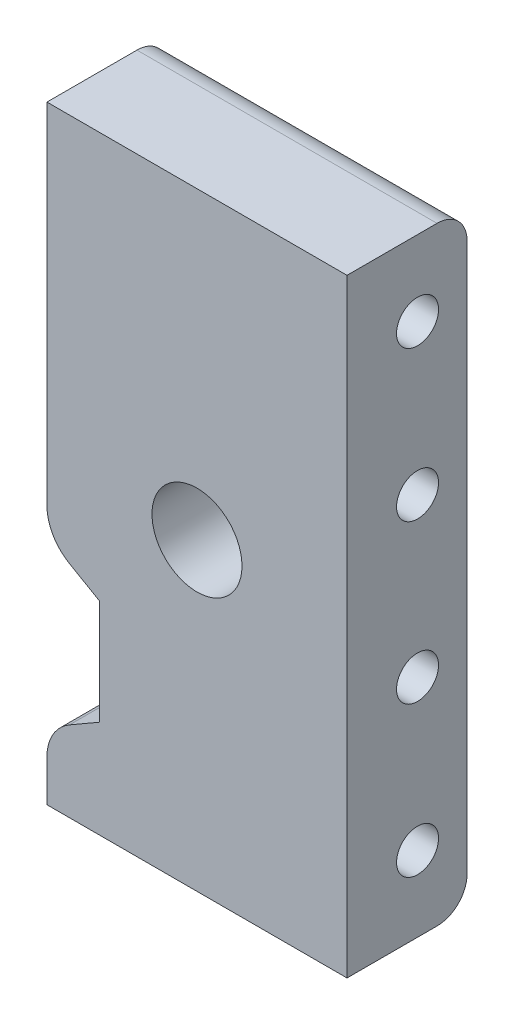
from build123d import *
from OCP.BRepFilletAPI import BRepFilletAPI_MakeChamfer

# Parameters (mm, degrees)
SKETCH1_W                     = 20
SKETCH1_H                     = 40.56076
BOSS_EXTRUDE1_DEPTH           = 8
SKETCH6_R                     = 1.4
CUT_EXTRUDE1_DEPTH            = 10
SKETCH8_R                     = 7.5
BOSS_EXTRUDE2_DEPTH           = 2.5
SKETCH9_R                     = 5.1
CUT_EXTRUDE3_DEPTH            = 4
SKETCH10_R                    = 3
CUT_EXTRUDE4_DEPTH            = 6.5
FILLET1_R                     = 2
CHAMFER1_SIZE2                = 2.5
CHAMFER1_SIZE                 = 1.8
SKETCH11_W                    = 8
SKETCH11_H                    = 7
CUT_EXTRUDE5_DEPTH            = 3.5
CHAMFER2_SIZE                 = 2.020725942
CHAMFER2_SIZE_2               = 3.5
FILLET2_R                     = 3
BODY_MOVE_COPY1_OUTLINE_W     = 2.1
BODY_MOVE_COPY1_OUTLINE_H     = 6.5
BODY_MOVE_COPY1_START         = -10
BODY_MOVE_COPY1_2_DEPTH       = 20
BODY_MOVE_COPY1_3_OUTLINE_R   = 1.4
BODY_MOVE_COPY1_3_DEPTH       = 4.176980959
BODY_MOVE_COPY1_4_OUTLINE_R   = 1.4
BODY_MOVE_COPY1_4_DEPTH       = 20
BODY_MOVE_COPY1_5_OUTLINE_R   = 1.4
BODY_MOVE_COPY1_5_DEPTH       = 10
BODY_MOVE_COPY1_6_OUTLINE_R   = 5.1
BODY_MOVE_COPY1_6_DEPTH       = 2.5
BODY_MOVE_COPY1_START_2       = -16
BODY_MOVE_COPY1_7_OUTLINE_R   = 3
BODY_MOVE_COPY1_7_DEPTH       = 8
BODY_MOVE_COPY1_8_OUTLINE_R   = 5.1
BODY_MOVE_COPY1_8_OUTLINE_R_2 = 3
BODY_MOVE_COPY1_8_DEPTH       = 1.5


with BuildPart() as part:
    # Sketch1 → Boss-Extrude1 (new body)
    with BuildSketch(Plane.XY):
        Rectangle(SKETCH1_W, SKETCH1_H)
    extrude(amount=-BOSS_EXTRUDE1_DEPTH)

    # Sketch6 → Cut-Extrude1 (cut)
    with BuildSketch(Plane(origin=(10, 0, 0), x_dir=(0, 0, -1), z_dir=(1, 0, 0))):
        with Locations(Location((3.3, -15.26519, 0), (0, 0, 180))):
            Circle(SKETCH6_R)
        with Locations((3.3, -5.26519)):
            Circle(SKETCH6_R)
        with Locations((3.3, 15.26519)):
            Circle(SKETCH6_R)
        with Locations(Location((3.3, 5.26519, 0), (0, 0, 180))):
            Circle(SKETCH6_R)
    extrude(amount=-CUT_EXTRUDE1_DEPTH, mode=Mode.SUBTRACT)

    # Sketch8 → Boss-Extrude2 (add)
    with BuildSketch(Plane.XY):
        Circle(SKETCH8_R)
    extrude(amount=BOSS_EXTRUDE2_DEPTH)

    # Sketch9 → Cut-Extrude3 (cut)
    with BuildSketch(Plane.XY.offset(2.5)):
        Circle(SKETCH9_R)
    extrude(amount=-CUT_EXTRUDE3_DEPTH, mode=Mode.SUBTRACT)

    # Sketch10 → Cut-Extrude4 (cut)
    with BuildSketch(Plane.XY.offset(-1.5)):
        Circle(SKETCH10_R)
    extrude(amount=-CUT_EXTRUDE4_DEPTH, mode=Mode.SUBTRACT)

    # Fillet1
    fillet1_edges = [part.edges().sort_by_distance(p)[0] for p in [
        (0, -20.28038, 0),
        (0, 20.28038, 0),
    ]]
    fillet(fillet1_edges, radius=FILLET1_R)

    # Chamfer1
    chamfer1_edges = [part.edges().sort_by_distance(p)[0] for p in [
        (-7.5, 0, 0),
    ]]
    chamfer1_side = [part.faces().sort_by_distance(p)[0] for p in [
        (-7.536, 0, 0),
    ]]
    chamfer(chamfer1_edges, length=CHAMFER1_SIZE - 0.0001, length2=CHAMFER1_SIZE2 - 0.0001, reference=chamfer1_side[0])  # a hair under: the kernel refuses the full size

    # Sketch11 → Cut-Extrude5 (cut)
    with BuildSketch(Plane.ZY.offset(10)):
        with Locations((-4, -10.26517)):
            Rectangle(SKETCH11_W, SKETCH11_H)
    extrude(amount=-CUT_EXTRUDE5_DEPTH, mode=Mode.SUBTRACT)

    # Chamfer2
    chamfer2_edges_1 = [part.edges().sort_by_distance(p)[0] for p in [
        (-10, -13.76517, -4),
    ]]
    chamfer2_side_1 = [part.faces().sort_by_distance(p)[0] for p in [
        (-10, -13.805584519, -4),
    ]]
    chamfer2_edges_2 = [part.edges().sort_by_distance(p)[0] for p in [
        (-10, -6.76517, -4),
    ]]
    chamfer2_side_2 = [part.faces().sort_by_distance(p)[0] for p in [
        (-9.959585481, -6.76517, -4),
    ]]
    chamfer2 = BRepFilletAPI_MakeChamfer(part.part.solid().wrapped)
    for e in chamfer2_edges_1:
        chamfer2.Add(CHAMFER2_SIZE - 0.0001, CHAMFER2_SIZE_2 - 0.0001, e.wrapped, chamfer2_side_1[0].wrapped)
    for e in chamfer2_edges_2:
        chamfer2.Add(CHAMFER2_SIZE_2 - 0.0001, CHAMFER2_SIZE - 0.0001, e.wrapped, chamfer2_side_2[0].wrapped)
    add(Compound.cast(chamfer2.Shape()), mode=Mode.REPLACE)  # a hair under: the kernel refuses the full size

    # Fillet2
    fillet2_edges = [part.edges().sort_by_distance(p)[0] for p in [
        (-10, -15.785795942, -4),
        (-10, -4.744544058, -4),
    ]]
    fillet(fillet2_edges, radius=FILLET2_R)

    # Body-Move/Copy1: read off the stored shape, not the designer's step
    # Body-Move/Copy1 outline → Body-Move/Copy1 (revolve)
    with BuildSketch(Plane.XZ):
        Polygon((7.5, -18.5), (9.3, -16), (5.1, -16), (5.1, -18.5), align=None)
        with Locations((4.05, -11.25)):
            Rectangle(BODY_MOVE_COPY1_OUTLINE_W, BODY_MOVE_COPY1_OUTLINE_H)
    revolve(axis=Axis((0, 0, 0), (0, 0, 1)))

    # Body-Move_Copy1 2 outline → Body-Move_Copy1 2 (cut)
    with BuildSketch(Plane.YZ.offset(BODY_MOVE_COPY1_START)):
        with BuildLine():
            Line((-20.28038, -8), (20.28038, -8))
            Line((20.28038, -8), (20.28038, -2))
            ThreePointArc((20.28038, -2), (19.694593562, -0.585786438), (18.28038, 0))
            Line((18.28038, 0), (-18.28038, 0))
            ThreePointArc((-18.28038, 0), (-19.694593562, -0.585786438), (-20.28038, -2))
            Line((-20.28038, -2), (-20.28038, -8))
        make_face()
    extrude(amount=BODY_MOVE_COPY1_2_DEPTH, mode=Mode.SUBTRACT)

    # Body-Move_Copy1 3 outline → Body-Move_Copy1 3 (cut)
    with BuildSketch(Plane.YZ):
        with Locations((-5.26519, -12.7)):
            Circle(BODY_MOVE_COPY1_3_OUTLINE_R)
        with Locations((5.26519, -12.7)):
            Circle(BODY_MOVE_COPY1_3_OUTLINE_R)
    extrude(amount=BODY_MOVE_COPY1_3_DEPTH, mode=Mode.SUBTRACT)

    # Body-Move_Copy1 4 outline → Body-Move_Copy1 4 (add)
    with BuildSketch(Plane.YZ.offset(BODY_MOVE_COPY1_START)):
        with BuildLine():
            ThreePointArc((18.28038, -16), (19.694593562, -15.414213562), (20.28038, -14))
            Line((20.28038, -14), (20.28038, -8))
            Line((20.28038, -8), (-20.28038, -8))
            Line((-20.28038, -8), (-20.28038, -14))
            ThreePointArc((-20.28038, -14), (-19.694593562, -15.414213562), (-18.28038, -16))
            Line((-18.28038, -16), (18.28038, -16))
        make_face()
        with Locations((-15.26519, -12.7)):
            Circle(BODY_MOVE_COPY1_4_OUTLINE_R, mode=Mode.SUBTRACT)
        with Locations((-5.26519, -12.7)):
            Circle(BODY_MOVE_COPY1_4_OUTLINE_R, mode=Mode.SUBTRACT)
        with Locations((5.26519, -12.7)):
            Circle(BODY_MOVE_COPY1_4_OUTLINE_R, mode=Mode.SUBTRACT)
        with Locations((15.26519, -12.7)):
            Circle(BODY_MOVE_COPY1_4_OUTLINE_R, mode=Mode.SUBTRACT)
    extrude(amount=BODY_MOVE_COPY1_4_DEPTH)

    # Body-Move_Copy1 5 outline → Body-Move_Copy1 5 (add)
    with BuildSketch(Plane.YZ.offset(BODY_MOVE_COPY1_START)):
        with Locations((-5.26519, -12.7)):
            Circle(BODY_MOVE_COPY1_5_OUTLINE_R)
        with Locations((15.26519, -12.7)):
            Circle(BODY_MOVE_COPY1_5_OUTLINE_R)
        with Locations((5.26519, -12.7)):
            Circle(BODY_MOVE_COPY1_5_OUTLINE_R)
        with Locations((-15.26519, -12.7)):
            Circle(BODY_MOVE_COPY1_5_OUTLINE_R)
    extrude(amount=BODY_MOVE_COPY1_5_DEPTH)

    # Body-Move_Copy1 6 outline → Body-Move_Copy1 6 (cut)
    with BuildSketch(Plane.XY):
        with BuildLine():
            Line((-6.5, -6.76517), (-6.5, -13.76517))
            Line((-6.5, -13.76517), (-8.5, -14.919870538))
            ThreePointArc((-8.5, -14.919870538), (-9.598076211, -16.01794675), (-10, -17.51794675))
            Line((-10, -17.51794675), (-10, -19))
            Line((-10, -19), (11, -19))
            Line((11, -19), (11, 11))
            Line((11, 11), (-10.000000008, 11))
            Line((-10.000000008, 11), (-10, -3.01239325))
            ThreePointArc((-10, -3.01239325), (-9.598076211, -4.51239325), (-8.5, -5.610469462))
            Line((-8.5, -5.610469462), (-6.5, -6.76517))
        make_face()
        Circle(BODY_MOVE_COPY1_6_OUTLINE_R, mode=Mode.SUBTRACT)
    extrude(amount=BODY_MOVE_COPY1_6_DEPTH, mode=Mode.SUBTRACT)

    # Body-Move_Copy1 7 outline → Body-Move_Copy1 7 (cut)
    with BuildSketch(Plane.XY.offset(BODY_MOVE_COPY1_START_2)):
        Circle(BODY_MOVE_COPY1_7_OUTLINE_R)
        with BuildLine():
            Line((-8.5, -14.919870538), (-6.5, -13.76517))
            Line((-6.5, -13.76517), (-6.5, -6.76517))
            Line((-6.5, -6.76517), (-8.5, -5.610469462))
            ThreePointArc((-8.5, -5.610469462), (-9.598076211, -4.51239325), (-10, -3.01239325))
            Line((-10, -3.01239325), (-10, -17.51794675))
            ThreePointArc((-10, -17.51794675), (-9.598076211, -16.01794675), (-8.5, -14.919870538))
        make_face()
    extrude(amount=BODY_MOVE_COPY1_7_DEPTH, mode=Mode.SUBTRACT)

    # Body-Move_Copy1 8 outline → Body-Move_Copy1 8 (cut)
    with BuildSketch(Plane.XY.offset(BODY_MOVE_COPY1_START_2)):
        Circle(BODY_MOVE_COPY1_8_OUTLINE_R)
        Circle(BODY_MOVE_COPY1_8_OUTLINE_R_2, mode=Mode.SUBTRACT)
    extrude(amount=BODY_MOVE_COPY1_8_DEPTH, mode=Mode.SUBTRACT)


solid = part.part
